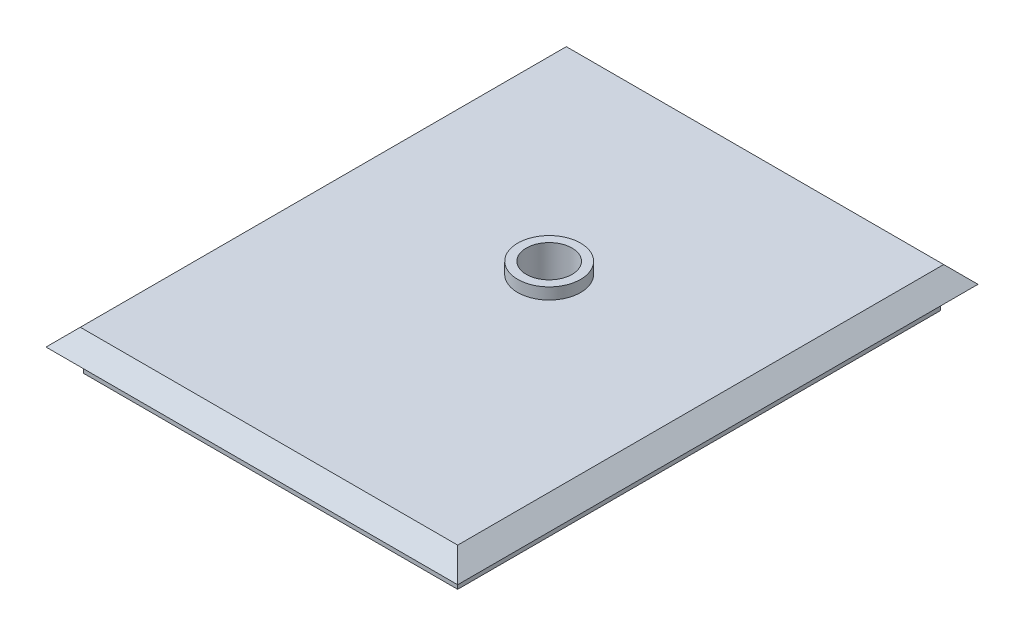
from build123d import *

# Parameters (mm, degrees)
TOP_EDGE_OUTLINE_W  = 86.5
TOP_EDGE_OUTLINE_H  = 39.5
TOP_EDGE_DEPTH      = 3
TOP_EDGE_DRAFT      = 45
SKETCH13_W          = 72
SKETCH13_H          = 25
DISPLAY_HOLE_DEPTH  = 6
SKETCH14_W          = 92.5
SKETCH14_H          = 45.5
SKETCH14_W_2        = 89.5
SKETCH14_H_2        = 42.5
BOSS_EXTRUDE5_DEPTH = 5
SKETCH15_W          = 128.5
SKETCH15_H          = 45.5
SKETCH15_W_2        = 89.5
SKETCH15_H_2        = 42.5
BOSS_EXTRUDE6_DEPTH = 2
SKETCH16_W          = 128.5
SKETCH16_H          = 45.5
SKETCH16_W_2        = 125.5
SKETCH16_H_2        = 42.5
BOSS_EXTRUDE7_DEPTH = 37
LOFT2_OUTLINE_W     = 33
LOFT2_OUTLINE_H     = 42.5
LOFT2_DEPTH         = 1.5
LOFT2_DRAFT         = 45
SKETCH19_R          = 2.75
SKETCH19_R_2        = 2
BOSS_EXTRUDE8_DEPTH = 1
CUT_EXTRUDE3_START  = -11
SKETCH20_R          = 2
CUT_EXTRUDE3_DEPTH  = 11
SKETCH21_W          = 12
SKETCH21_H          = 8
CUT_EXTRUDE4_DEPTH  = 11
SKETCH22_W          = 4
SKETCH22_H          = 15
BOSS_EXTRUDE9_DEPTH = 3
SKETCH24_W          = 42.5
SKETCH24_H          = 37
CUT_EXTRUDE5_DEPTH  = 17
SKETCH26_W          = 144.369132995
SKETCH26_H          = 91.038744315
CUT_EXTRUDE6_DEPTH  = 87
SKETCH27_W          = 64.71229982
SKETCH27_H          = 55.593249081
CUT_EXTRUDE7_DEPTH  = 148
SKETCH29_W          = 36
SKETCH29_H          = 45.5
SKETCH29_W_2        = 32.7
SKETCH29_H_2        = 42.2
CUT_EXTRUDE8_DEPTH  = 2


# Read off the part's stored shape, not the designer's step: Top Edge, Loft2
with BuildPart() as part:
    # Top Edge outline → Top Edge (with draft: the straight prism first)
    with BuildSketch(Plane(origin=(0, 0, 0), x_dir=(1, 0, 0), z_dir=(0, 1, 0))):
        with Locations((0.25, -0.25)):
            Rectangle(TOP_EDGE_OUTLINE_W, TOP_EDGE_OUTLINE_H)
    extrude(amount=-TOP_EDGE_DEPTH)
    # Top Edge: the draft: its side faces are tilted about the plane it starts from
    top_edge_sides = [part.faces().sort_by_distance(p)[0] for p in [
        (-43, -1.5, 0.25),
        (0.25, -1.5, 20),
        (43.5, -1.5, 0.25),
        (0.25, -1.5, -19.5),
    ]]
    draft(top_edge_sides, Plane(origin=(0, 0, 0), x_dir=(1, 0, 0), z_dir=(0, 1, 0)), TOP_EDGE_DRAFT)

    # Sketch13 → Display Hole (cut)
    with BuildSketch(Plane(origin=(0, 0, 0), x_dir=(1, 0, 0), z_dir=(0, 1, 0))):
        Rectangle(SKETCH13_W, SKETCH13_H)
    extrude(amount=-DISPLAY_HOLE_DEPTH, mode=Mode.SUBTRACT)

    # Sketch14 → Boss-Extrude5 (add)
    with BuildSketch(Plane.XZ.offset(3)):
        with Locations((0.25, 0.25)):
            Rectangle(SKETCH14_W, SKETCH14_H)
        with Locations((0.25, 0.25)):
            Rectangle(SKETCH14_W_2, SKETCH14_H_2, mode=Mode.SUBTRACT)
    extrude(amount=BOSS_EXTRUDE5_DEPTH)

    # Sketch15 → Boss-Extrude6 (add)
    with BuildSketch(Plane.XZ.offset(8)):
        with Locations((18.25, 0.25)):
            Rectangle(SKETCH15_W, SKETCH15_H)
        with Locations((0.25, 0.25)):
            Rectangle(SKETCH15_W_2, SKETCH15_H_2, mode=Mode.SUBTRACT)
    extrude(amount=BOSS_EXTRUDE6_DEPTH)

    # Sketch16 → Boss-Extrude7 (add)
    with BuildSketch(Plane.XZ.offset(10)):
        with Locations((18.25, 0.25)):
            Rectangle(SKETCH16_W, SKETCH16_H)
        with Locations((18.25, 0.25)):
            Rectangle(SKETCH16_W_2, SKETCH16_H_2, mode=Mode.SUBTRACT)
    extrude(amount=BOSS_EXTRUDE7_DEPTH)


with BuildPart() as loft2_tool:
    # Loft2 outline → Loft2 (with draft: the straight prism first)
    with BuildSketch(Plane(origin=(0, -6.5, 0), x_dir=(1, 0, 0), z_dir=(0, 1, 0))):
        with Locations((64.5, -0.25)):
            Rectangle(LOFT2_OUTLINE_W, LOFT2_OUTLINE_H)
    extrude(amount=-LOFT2_DEPTH)
    # Loft2: the draft: its side faces are tilted about the plane it starts from
    loft2_sides = [loft2_tool.faces().sort_by_distance(p)[0] for p in [
        (81, -7.25, 0.25),
        (64.5, -7.25, -21),
        (48, -7.25, 0.25),
        (64.5, -7.25, 21.5),
    ]]
    draft(loft2_sides, Plane(origin=(0, -6.5, 0), x_dir=(1, 0, 0), z_dir=(0, 1, 0)), LOFT2_DRAFT)


with BuildPart() as part_1:
    add(part.part)

    # Loft2: add loft2_tool
    add(loft2_tool.part)

    # Sketch19 → Boss-Extrude8 (add)
    with BuildSketch(Plane(origin=(0, -6.5, 0), x_dir=(1, 0, 0), z_dir=(0, 1, 0))):
        with Locations(Location((64.5, 3, 0), (0, 0, 270))):
            Circle(SKETCH19_R)
        with Locations(Location((64.5, 3, 0), (0, 0, 270))):
            Circle(SKETCH19_R_2, mode=Mode.SUBTRACT)
    extrude(amount=BOSS_EXTRUDE8_DEPTH)

    # Sketch20 → Cut-Extrude3 (cut)
    with BuildSketch(Plane(origin=(0, -6.5, 0), x_dir=(1, 0, 0), z_dir=(0, 1, 0)).offset(CUT_EXTRUDE3_START)):
        with Locations(Location((64.5, 3, 0), (0, 0, 90))):
            Circle(SKETCH20_R)
    extrude(amount=CUT_EXTRUDE3_DEPTH, mode=Mode.SUBTRACT)

    # Sketch21 → Cut-Extrude4 (cut)
    with BuildSketch(Plane(origin=(82.5, 0, 0), x_dir=(0, 0, -1), z_dir=(1, 0, 0))):
        with Locations((0, -43)):
            Rectangle(SKETCH21_W, SKETCH21_H)
    extrude(amount=-CUT_EXTRUDE4_DEPTH, mode=Mode.SUBTRACT)

    # Sketch22 → Boss-Extrude9 (add)
    with BuildSketch(Plane.XZ.offset(3)):
        with Locations((-38, 0)):
            Rectangle(SKETCH22_W, SKETCH22_H)
    extrude(amount=BOSS_EXTRUDE9_DEPTH)

    # Sketch24 → Cut-Extrude5 (cut)
    with BuildSketch(Plane.ZY.offset(-81)):
        with Locations((0.25, -28.5)):
            Rectangle(SKETCH24_W, SKETCH24_H)
    extrude(amount=-CUT_EXTRUDE5_DEPTH, mode=Mode.SUBTRACT)

    # Sketch26 → Cut-Extrude6 (cut)
    with BuildSketch(Plane.XZ.offset(10)):
        with Locations((18.609127197, -2.802581171)):
            Rectangle(SKETCH26_W, SKETCH26_H)
    extrude(amount=CUT_EXTRUDE6_DEPTH, mode=Mode.SUBTRACT)

    # Sketch27 → Cut-Extrude7 (cut)
    with BuildSketch(Plane(origin=(46.5, 0, 0), x_dir=(0, 0, -1), z_dir=(1, 0, 0))):
        with Locations((3.100976476, -7.362126245)):
            Rectangle(SKETCH27_W, SKETCH27_H)
    extrude(amount=-CUT_EXTRUDE7_DEPTH, mode=Mode.SUBTRACT)

    # Sketch29 → Cut-Extrude8 (cut)
    with BuildSketch(Plane.XZ.offset(10)):
        with Locations((64.5, 0.25)):
            Rectangle(SKETCH29_W, SKETCH29_H)
        with Locations((64.5, 0.25)):
            Rectangle(SKETCH29_W_2, SKETCH29_H_2, mode=Mode.SUBTRACT)
    extrude(amount=-CUT_EXTRUDE8_DEPTH, mode=Mode.SUBTRACT)


solid = part_1.part
